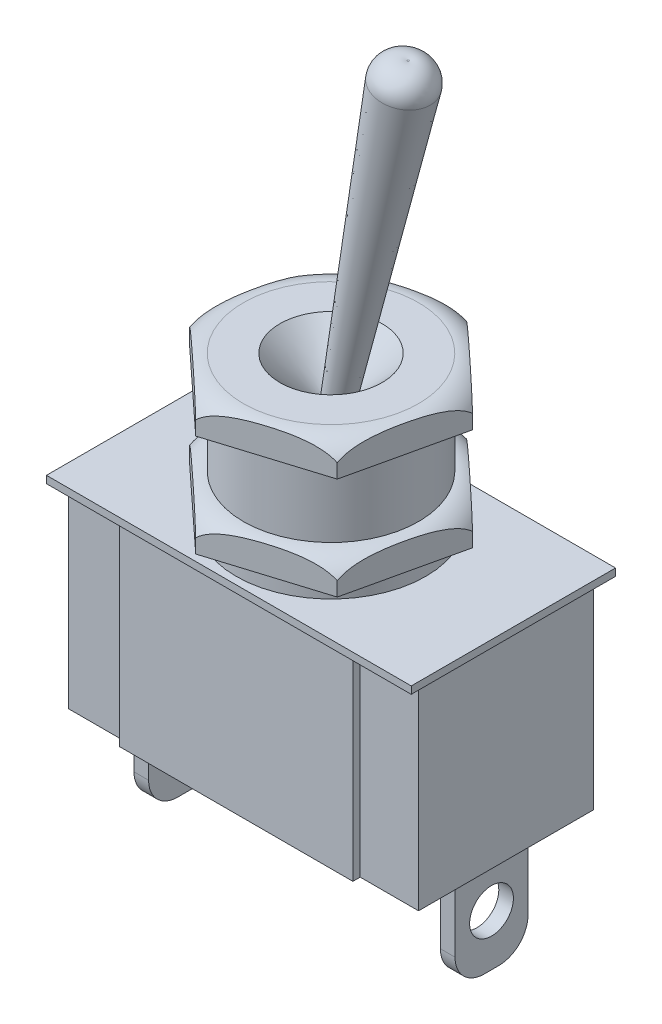
from build123d import *

# Parameters (mm, degrees)
BOSS_EXTRUDE2_DEPTH    = 13.6
SKETCH3_W              = 25
SKETCH3_H              = 14
BOSS_EXTRUDE3_DEPTH    = 0.5
SKETCH4_R              = 6
BOSS_EXTRUDE4_DEPTH    = 10
SKETCH5_R              = 6.5
BOSS_EXTRUDE5_DEPTH    = 1
SKETCH6_R              = 8
BOSS_EXTRUDE6_DEPTH    = 2
BOSS_EXTRUDE7_START    = 5
SKETCH7_R              = 8
BOSS_EXTRUDE7_DEPTH    = 2
FILLET1_R              = 1.5
FILLET2_R              = 2
CUT_EXTRUDE2_START     = -9
CUT_EXTRUDE2_OUTLINE_R = 8
CUT_EXTRUDE2_DEPTH     = 8.869095969
SKETCH13_W             = 1
SKETCH13_H             = 5
BOSS_EXTRUDE8_DEPTH    = 7
SKETCH14_R             = 1.5
CUT_EXTRUDE3_DEPTH     = 40.357608105
FILLET3_R              = 2


# Read off the part's stored shape, not the designer's step: Cut-Extrude2
with BuildPart() as part:
    # Sketch1 → Boss-Extrude2 (new body)
    with BuildSketch(Plane(origin=(0, 0, 0), x_dir=(1, 0, 0), z_dir=(0, 1, 0))):
        Polygon((-12, 6), (-8, 6), (-8, 6.5), (8, 6.5), (8, 6), (12, 6), (12, -6), (8, -6), (8, -6.5), (-8, -6.5), (-8, -6), (-12, -6), align=None)
    extrude(amount=-BOSS_EXTRUDE2_DEPTH)

    # Sketch3 → Boss-Extrude3 (add)
    with BuildSketch(Plane(origin=(0, 0, 0), x_dir=(1, 0, 0), z_dir=(0, 1, 0))):
        Rectangle(SKETCH3_W, SKETCH3_H)
    extrude(amount=BOSS_EXTRUDE3_DEPTH)

    # Sketch4 → Boss-Extrude4 (add)
    with BuildSketch(Plane(origin=(0, 0.5, 0), x_dir=(1, 0, 0), z_dir=(0, 1, 0))):
        with Locations(Location((0, 0, 0), (0, 0, 270))):
            Circle(SKETCH4_R)
    extrude(amount=BOSS_EXTRUDE4_DEPTH)

    # Sketch5 → Boss-Extrude5 (add)
    with BuildSketch(Plane(origin=(0, 0.5, 0), x_dir=(1, 0, 0), z_dir=(0, 1, 0))):
        with Locations(Location((0, 0, 0), (0, 0, 90))):
            Circle(SKETCH5_R)
    extrude(amount=BOSS_EXTRUDE5_DEPTH)

    # Sketch6 → Boss-Extrude6 (add)
    with BuildSketch(Plane(origin=(0, 1.5, 0), x_dir=(1, 0, 0), z_dir=(0, 1, 0))):
        with Locations(Location((0, 0, 0), (0, 0, 270))):
            Circle(SKETCH6_R)
    extrude(amount=BOSS_EXTRUDE6_DEPTH)

    # Sketch7 → Boss-Extrude7 (add)
    with BuildSketch(Plane(origin=(0, 3.5, 0), x_dir=(1, 0, 0), z_dir=(0, 1, 0)).offset(BOSS_EXTRUDE7_START)):
        with Locations(Location((0, 0, 0), (0, 0, 270))):
            Circle(SKETCH7_R)
    extrude(amount=BOSS_EXTRUDE7_DEPTH)

    # Cut-Extrude1 cone 1 section (through the dimple's axis) → Cut-Extrude1 (revolve, cut)
    with BuildSketch(Plane(origin=(0, 10.5, 0), x_dir=(0, 0, 1), z_dir=(1, 0, 0))):
        Polygon((0, 0), (3.5, 0), (0, 3.5), align=None)
    revolve(axis=Axis((0, 10.5, 0), (0, -1, 0)), mode=Mode.SUBTRACT)

    # Sketch8 → Revolve2 (revolve)
    with BuildSketch(Plane.XY, mode=Mode.PRIVATE) as revolve2_sk:
        Polygon((0, 5.593050937), (5.294135454, 30.5), (7.294135454, 30.5), (0.500139858, 4.447468062), align=None)
    revolve(revolve2_sk.sketch.rotate(Axis((0, 5.593050937, 0), (0.2079116908177598, 0.9781476007338056, 0)), 168.394014695), axis=Axis((0, 5.593050937, 0), (0.2079116908177598, 0.9781476007338056, 0)))

    # Fillet1
    fillet1_edges = [part.edges().sort_by_distance(p)[0] for p in [
        (7.255011561, 30.50831604, 0.393567957),
    ]]
    fillet(fillet1_edges, radius=FILLET1_R)

    # Fillet2
    fillet2_edges = [part.edges().sort_by_distance(p)[0] for p in [
        (0, 3.5, -8),
        (0, 10.5, -8),
    ]]
    fillet(fillet2_edges, radius=FILLET2_R - 0.0001)  # a hair under: the kernel refuses the full size

    # Cut-Extrude2 outline → Cut-Extrude2 (cut)
    with BuildSketch(Plane(origin=(0, 10.5, 0), x_dir=(1, 0, 0), z_dir=(0, 1, 0)).offset(CUT_EXTRUDE2_START)):
        Circle(CUT_EXTRUDE2_OUTLINE_R)
        Polygon((-1.711953383, -7.558552481), (-7.401875156, -2.296681121), (-5.689921773, 5.26187136), (1.711953383, 7.558552481), (7.401875156, 2.296681121), (5.689921773, -5.26187136), align=None, mode=Mode.SUBTRACT)
    extrude(amount=CUT_EXTRUDE2_DEPTH, mode=Mode.SUBTRACT)

    # Sketch13 → Boss-Extrude8 (add)
    with BuildSketch(Plane.XZ.offset(13.6)):
        with Locations((10.5, 0)):
            Rectangle(SKETCH13_W, SKETCH13_H)
    boss_extrude8 = extrude(amount=BOSS_EXTRUDE8_DEPTH)

    # Mirror1: Boss-Extrude8 across plane
    add(boss_extrude8.mirror(Plane(origin=(0, 0, 0), x_dir=(0, 0, 1), z_dir=(1, 0, 0))))

    # Sketch14 → Cut-Extrude3 (cut, through all)
    with BuildSketch(Plane(origin=(11, 0, 0), x_dir=(0, 0, -1), z_dir=(1, 0, 0))):
        with Locations((0, -17.1)):
            Circle(SKETCH14_R)
    extrude(amount=-CUT_EXTRUDE3_DEPTH, mode=Mode.SUBTRACT)

    # Fillet3
    fillet3_edges = [part.edges().sort_by_distance(p)[0] for p in [
        (10.5, -20.6, 2.5),
        (10.5, -20.6, -2.5),
        (-10.5, -20.6, -2.5),
        (-10.5, -20.6, 2.5),
    ]]
    fillet(fillet3_edges, radius=FILLET3_R)


solid = part.part
